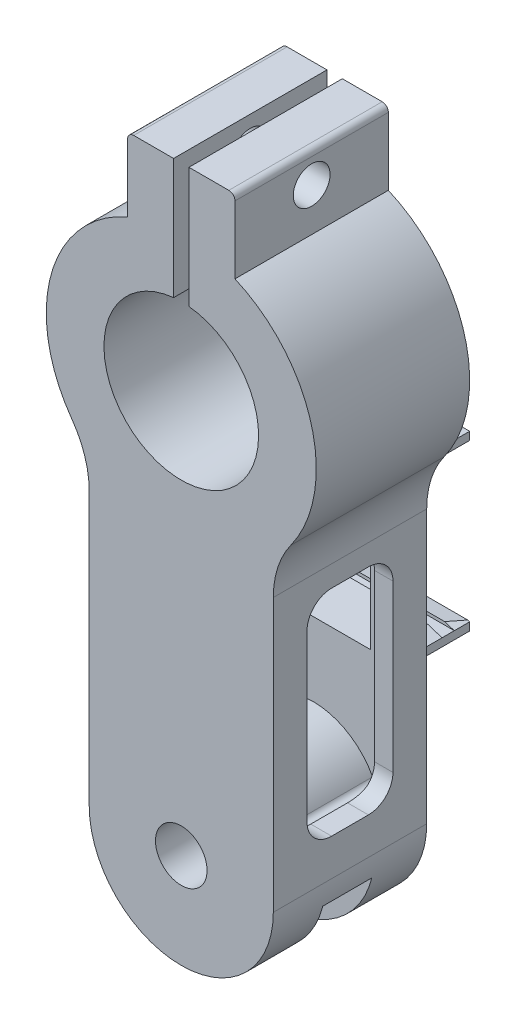
from build123d import *

# Parameters (mm, degrees)
BOSS_EXTRUDE1_DEPTH      = 25
CUT_EXTRUDE4_START       = 8.5
CUT_EXTRUDE4_DEPTH       = 8
SKETCH10_R               = 4.2
CUT_EXTRUDE6_DEPTH       = 99.764673235
SKETCH11_W               = 24
SKETCH11_H               = 29.6
BOSS_EXTRUDE2_DEPTH      = 10
CUT_EXTRUDE7_DEPTH       = 99.764673235
CUT_EXTRUDE8_START       = 5.5
SKETCH14_W               = 24
SKETCH14_H               = 25.6
CUT_EXTRUDE8_DEPTH       = 2
SKETCH22_R               = 12.6
CUT_EXTRUDE16_DEPTH      = 99.764673235
SKETCH24_W               = 17.5
SKETCH24_H               = 12
BOSS_EXTRUDE3_DEPTH      = 25
FILLET6_R                = 15
FILLET7_R                = 1
SKETCH25_R               = 3
CUT_EXTRUDE18_DEPTH      = 25
SKETCH26_W               = 2.5
SKETCH26_H               = 20
CUT_EXTRUDE19_DEPTH      = 25
SHELL14_START            = 9.25
SHELL14_DEPTH            = 1.5
SHELL14_START_2          = 3
SHELL14_2_DEPTH          = 19
SHELL14_3_OUTLINE_R      = 9.2
SHELL14_3_DEPTH          = 0.5
SHELL14_START_3          = 21.5
SHELL14_4_OUTLINE_R      = 9.2
SHELL14_4_DEPTH          = 0.5
SHELL14_START_4          = 8
SHELL14_5_DEPTH          = 2.75
SHELL14_START_5          = 19.25
SHELL14_6_DEPTH          = 1.5
SKETCH27_W               = 17.72
SKETCH27_H               = 24
CUT_EXTRUDE20_DEPTH      = 10
SKETCH28_W               = 14
SKETCH28_H               = 35
CUT_EXTRUDE21_DEPTH      = 3
SKETCH29_W               = 14
SKETCH29_H               = 35
CUT_EXTRUDE22_DEPTH      = 3
FILLET8_R                = 4
FILLET9_START            = 3.5
FILLET9_DEPTH            = 18
FILLET9_START_2          = 15.4999999
FILLET9_2_DEPTH          = 6.0000001
FILLET9_3_DEPTH          = 6
FILLET9_START_3          = 26.598008456
FILLET9_4_DEPTH          = 0.401991544
FILLET9_START_4          = 3
FILLET9_5_DEPTH          = 0.401990551
FILLET10_R               = 1
CUT_EXTRUDE23_DEPTH      = 108.947556596
CUT_EXTRUDE23_DEPTH_BACK = 108.947556596
SKETCH32_W               = 24
SKETCH32_H               = 0.7
CUT_EXTRUDE24_DEPTH      = 108.947556596
FILLET11_R               = 3
BOSS_EXTRUDE4_REACH      = 109.948
SKETCH33_W               = 28
SKETCH33_H               = 2


with BuildPart() as part:
    # Sketch1 → Boss-Extrude1 (new body)
    with BuildSketch(Plane.XY):
        with BuildLine():
            Line((30, 0), (30, 50))
            ThreePointArc((30, 50), (15, 88.093476939), (0, 50))
            Line((0, 50), (0, 0))
            ThreePointArc((0, 0), (15, -15), (30, 0))
        make_face()
    extrude(amount=BOSS_EXTRUDE1_DEPTH)

    # Sketch9 → Cut-Extrude4 (cut)
    with BuildSketch(Plane.XY.offset(CUT_EXTRUDE4_START)):
        with BuildLine():
            Line((7.015640289, 0), (0, -3.844579475))
            Line((0, -3.844579475), (0, -19.136394538))
            Line((0, -19.136394538), (30, -19.136394538))
            Line((30, -19.136394538), (30, -3.844579475))
            Line((30, -3.844579475), (22.984359711, 0))
            ThreePointArc((22.984359711, 0), (15, 8.5), (7.015640289, 0))
        make_face()
    extrude(amount=CUT_EXTRUDE4_DEPTH, mode=Mode.SUBTRACT)

    # Sketch10 → Cut-Extrude6 (cut, through all)
    with BuildSketch(Plane.XY):
        with Locations(Location((15, 0.5, 0), (0, 0, 180))):
            Circle(SKETCH10_R)
    extrude(amount=CUT_EXTRUDE6_DEPTH, mode=Mode.SUBTRACT)

    # Sketch11 → Boss-Extrude2 (add)
    with BuildSketch(Plane(origin=(0, 0, 0), x_dir=(-1, 0, 0), z_dir=(0, 0, -1))):
        with Locations((-15, 34.8)):
            Rectangle(SKETCH11_W, SKETCH11_H)
    extrude(amount=BOSS_EXTRUDE2_DEPTH)

    # Sketch12 → Cut-Extrude7 (cut, through all)
    with BuildSketch(Plane(origin=(0, 0, 0), x_dir=(-1, 0, 0), z_dir=(0, 0, -1))):
        Polygon((-3, 47.6), (-3, 22), (-6.14, 23), (-23.86, 23), (-27, 22), (-27, 47.6), (-23.86, 46.6), (-6.14, 46.6), align=None)
    extrude(amount=CUT_EXTRUDE7_DEPTH, mode=Mode.SUBTRACT)

    # Sketch14 → Cut-Extrude8 (cut)
    with BuildSketch(Plane(origin=(0, 0, 0), x_dir=(-1, 0, 0), z_dir=(0, 0, -1)).offset(CUT_EXTRUDE8_START)):
        with Locations((-15, 34.8)):
            Rectangle(SKETCH14_W, SKETCH14_H)
    extrude(amount=CUT_EXTRUDE8_DEPTH, mode=Mode.SUBTRACT)

    # Sketch22 → Cut-Extrude16 (cut, through all)
    with BuildSketch(Plane.XY):
        with Locations((15, 66.093476939)):
            Circle(SKETCH22_R)
    extrude(amount=CUT_EXTRUDE16_DEPTH, mode=Mode.SUBTRACT)

    # Sketch24 → Boss-Extrude3 (add)
    with BuildSketch(Plane.XY):
        with Locations((15, 92.278558064)):
            Rectangle(SKETCH24_W, SKETCH24_H)
    extrude(amount=BOSS_EXTRUDE3_DEPTH)

    # Fillet6
    fillet6_edges = [part.edges().sort_by_distance(p)[0] for p in [
        (0, 50, 12.5),
        (30, 50, 12.5),
    ]]
    fillet(fillet6_edges, radius=FILLET6_R)

    # Fillet7
    fillet7_edges = [part.edges().sort_by_distance(p)[0] for p in [
        (6.25, 98.278558064, 12.5),
        (23.75, 98.278558064, 12.5),
    ]]
    fillet(fillet7_edges, radius=FILLET7_R)

    # Sketch25 → Cut-Extrude18 (cut)
    with BuildSketch(Plane(origin=(23.75, 0, 23.75), x_dir=(0, 0, 1), z_dir=(-1, 0, 0))):
        with Locations(Location((-11.25, 93.278558064, 0), (0, 0, 180))):
            Circle(SKETCH25_R)
    extrude(amount=CUT_EXTRUDE18_DEPTH, mode=Mode.SUBTRACT)

    # Sketch26 → Cut-Extrude19 (cut)
    with BuildSketch(Plane(origin=(0, 0, 0), x_dir=(-1, 0, 0), z_dir=(0, 0, -1))):
        with Locations((-15, 88.278558064)):
            Rectangle(SKETCH26_W, SKETCH26_H)
    extrude(amount=-CUT_EXTRUDE19_DEPTH, mode=Mode.SUBTRACT)

    # Shell14: read off the stored shape, not the designer's step
    # Shell14 outline → Shell14 (cut)
    with BuildSketch(Plane.YZ.offset(SHELL14_START)):
        with BuildLine():
            Line((93.278558064, 22), (88.278558064, 22))
            Line((88.278558064, 22), (88.278558064, 15.81662479))
            ThreePointArc((88.278558064, 15.81662479), (90.441283733, 17.786764074), (93.278558064, 18.5))
            Line((93.278558064, 18.5), (93.278558064, 22))
        make_face()
        with BuildLine():
            ThreePointArc((93.278558064, 6.5), (90.441283733, 7.213235926), (88.278558064, 9.18337521))
            Line((88.278558064, 9.18337521), (88.278558064, 3))
            Line((88.278558064, 3), (93.278558064, 3))
            Line((93.278558064, 3), (93.278558064, 6.5))
        make_face()
    extrude(amount=SHELL14_DEPTH, mode=Mode.SUBTRACT)

    # Shell14 2 outline → Shell14 2 (cut)
    with BuildSketch(Plane.XY.offset(SHELL14_START_2)):
        with BuildLine():
            Line((20.75, 88.278558064), (19.25, 88.278558064))
            Line((19.25, 88.278558064), (19.25, 81.10339033))
            ThreePointArc((19.25, 81.10339033), (15, 50.493476939), (10.75, 81.10339033))
            Line((10.75, 81.10339033), (10.75, 88.278558064))
            Line((10.75, 88.278558064), (9.25, 88.278558064))
            Line((9.25, 88.278558064), (9.25, 84.202521641))
            ThreePointArc((9.25, 84.202521641), (-3.041191716, 72.052956906), (-0.405405405, 54.972618866))
            ThreePointArc((-0.405405405, 54.972618866), (2.127502776, 49.973191279), (3, 44.437069112))
            Line((3, 44.437069112), (3, 3.500970796))
            Line((3, 3.500970796), (4.734171365, 4.451298829))
            ThreePointArc((4.734171365, 4.451298829), (15, 11.5), (25.265828635, 4.451298829))
            Line((25.265828635, 4.451298829), (27, 3.500970796))
            Line((27, 3.500970796), (27, 44.437069112))
            ThreePointArc((27, 44.437069112), (27.872497224, 49.973191279), (30.405405405, 54.972618866))
            ThreePointArc((30.405405405, 54.972618866), (33.041191716, 72.052956906), (20.75, 84.202521641))
            Line((20.75, 84.202521641), (20.75, 88.278558064))
        make_face()
    extrude(amount=SHELL14_2_DEPTH, mode=Mode.SUBTRACT)

    # Shell14 3 outline → Shell14 3 (cut)
    with BuildSketch(Plane.XY.offset(SHELL14_START_2)):
        with BuildLine():
            Line((27, 0), (27, 3.500970796))
            Line((27, 3.500970796), (25.265828635, 4.451298829))
            ThreePointArc((25.265828635, 4.451298829), (15, 11.5), (4.734171365, 4.451298829))
            Line((4.734171365, 4.451298829), (3, 3.500970796))
            Line((3, 3.500970796), (3, 0))
            ThreePointArc((3, 0), (15, -12), (27, 0))
        make_face()
        with Locations((15, 0.5)):
            Circle(SHELL14_3_OUTLINE_R, mode=Mode.SUBTRACT)
    extrude(amount=SHELL14_3_DEPTH, mode=Mode.SUBTRACT)

    # Shell14 4 outline → Shell14 4 (cut)
    with BuildSketch(Plane.XY.offset(SHELL14_START_3)):
        with BuildLine():
            Line((27, 0), (27, 3.500970796))
            Line((27, 3.500970796), (25.265828635, 4.451298829))
            ThreePointArc((25.265828635, 4.451298829), (15, 11.5), (4.734171365, 4.451298829))
            Line((4.734171365, 4.451298829), (3, 3.500970796))
            Line((3, 3.500970796), (3, 0))
            ThreePointArc((3, 0), (15, -12), (27, 0))
        make_face()
        with Locations((15, 0.5)):
            Circle(SHELL14_4_OUTLINE_R, mode=Mode.SUBTRACT)
    extrude(amount=SHELL14_4_DEPTH, mode=Mode.SUBTRACT)

    # Shell14 5 outline → Shell14 5 (add)
    with BuildSketch(Plane.YZ.offset(SHELL14_START_4)):
        with BuildLine():
            Line((88.278558064, 9.18337521), (88.278558064, 15.81662479))
            ThreePointArc((88.278558064, 15.81662479), (87.278558064, 12.5), (88.278558064, 9.18337521))
        make_face()
    extrude(amount=SHELL14_5_DEPTH)

    # Shell14 6 outline → Shell14 6 (add)
    with BuildSketch(Plane.YZ.offset(SHELL14_START_5)):
        with BuildLine():
            Line((88.278558064, 9.18337521), (88.278558064, 15.81662479))
            ThreePointArc((88.278558064, 15.81662479), (87.278558064, 12.5), (88.278558064, 9.18337521))
        make_face()
    extrude(amount=SHELL14_6_DEPTH)

    # Sketch27 → Cut-Extrude20 (cut)
    with BuildSketch(Plane(origin=(0, 0, 0), x_dir=(-1, 0, 0), z_dir=(0, 0, -1))):
        with Locations((-15, 35)):
            Rectangle(SKETCH27_W, SKETCH27_H)
    extrude(amount=-CUT_EXTRUDE20_DEPTH, mode=Mode.SUBTRACT)

    # Sketch28 → Cut-Extrude21 (cut)
    with BuildSketch(Plane.ZY):
        with Locations((12.5, 23.5)):
            Rectangle(SKETCH28_W, SKETCH28_H)
    extrude(amount=-CUT_EXTRUDE21_DEPTH, mode=Mode.SUBTRACT)

    # Sketch29 → Cut-Extrude22 (cut)
    with BuildSketch(Plane(origin=(30, 0, -30), x_dir=(0, 0, 1), z_dir=(-1, 0, 0))):
        with Locations((42.5, 23.5)):
            Rectangle(SKETCH29_W, SKETCH29_H)
    extrude(amount=CUT_EXTRUDE22_DEPTH, mode=Mode.SUBTRACT)

    # Fillet8
    fillet8_edges = [part.edges().sort_by_distance(p)[0] for p in [
        (1.5, 6, 19.5),
        (1.5, 41, 19.5),
        (1.5, 41, 5.5),
        (1.5, 6, 5.5),
        (28.5, 41, 5.5),
        (28.5, 6, 5.5),
        (28.5, 6, 19.5),
        (28.5, 41, 19.5),
    ]]
    fillet(fillet8_edges, radius=FILLET8_R)

    # Fillet9: read off the stored shape, not the designer's step
    # Fillet9 outline → Fillet9 (add)
    with BuildSketch(Plane.XY.offset(FILLET9_START)):
        with BuildLine():
            Line((3.401990551, 6), (3, 6))
            Line((3, 6), (3, 3.500970796))
            Line((3, 3.500970796), (4.734171365, 4.451298829))
            ThreePointArc((4.734171365, 4.451298829), (3.967547511, 5.139171318), (3.401990551, 6))
        make_face()
        with BuildLine():
            Line((27, 3.500970796), (27, 6))
            Line((27, 6), (26.598009449, 6))
            ThreePointArc((26.598009449, 6), (26.032452489, 5.139171318), (25.265828635, 4.451298829))
            Line((25.265828635, 4.451298829), (27, 3.500970796))
        make_face()
    extrude(amount=FILLET9_DEPTH)

    # Fillet9 2 outline → Fillet9 2 (add)
    with BuildSketch(Plane.XY.offset(FILLET9_START_2)):
        with BuildLine():
            Line((3, 7.747663584), (3, 6))
            Line((3, 6), (3.401990551, 6))
            ThreePointArc((3.401990551, 6), (3.101792861, 6.851013651), (3, 7.747663584))
        make_face()
        with BuildLine():
            Line((26.598009449, 6), (27, 6))
            Line((27, 6), (27, 7.747663584))
            ThreePointArc((27, 7.747663584), (26.898207139, 6.851013651), (26.598009449, 6))
        make_face()
    extrude(amount=FILLET9_2_DEPTH)

    # Fillet9 3 outline → Fillet9 3 (add)
    with BuildSketch(Plane.XY.offset(FILLET9_START)):
        with BuildLine():
            Line((3, 7.747663584), (3, 6))
            Line((3, 6), (3.401990551, 6))
            ThreePointArc((3.401990551, 6), (3.101792861, 6.851013651), (3, 7.747663584))
        make_face()
        with BuildLine():
            Line((26.598009449, 6), (27, 6))
            Line((27, 6), (27, 7.747663584))
            ThreePointArc((27, 7.747663584), (26.898207139, 6.851013651), (26.598009449, 6))
        make_face()
    extrude(amount=FILLET9_3_DEPTH)

    # Fillet9 4 outline → Fillet9 4 (cut)
    with BuildSketch(Plane.YZ.offset(FILLET9_START_3)):
        with BuildLine():
            ThreePointArc((6, 9.5), (6.463805318, 7.630420591), (7.747663584, 6.194401617))
            Line((7.747663584, 6.194401617), (7.747663584, 9.5))
            Line((7.747663584, 9.5), (6, 9.5))
        make_face()
        with BuildLine():
            Line((6, 15.5), (7.747663584, 15.4999999))
            Line((7.747663584, 15.4999999), (7.747663584, 18.805598383))
            ThreePointArc((7.747663584, 18.805598383), (6.463805318, 17.369579409), (6, 15.5))
        make_face()
    extrude(amount=FILLET9_4_DEPTH, mode=Mode.SUBTRACT)

    # Fillet9 5 outline → Fillet9 5 (cut)
    with BuildSketch(Plane.YZ.offset(FILLET9_START_4)):
        with BuildLine():
            ThreePointArc((6, 9.5), (6.463805318, 7.630420591), (7.747663584, 6.194401617))
            Line((7.747663584, 6.194401617), (7.747663584, 9.5))
            Line((7.747663584, 9.5), (6, 9.5))
        make_face()
        with BuildLine():
            Line((6, 15.5), (7.747663584, 15.4999999))
            Line((7.747663584, 15.4999999), (7.747663584, 18.805598383))
            ThreePointArc((7.747663584, 18.805598383), (6.463805318, 17.369579409), (6, 15.5))
        make_face()
    extrude(amount=FILLET9_5_DEPTH, mode=Mode.SUBTRACT)

    # Fillet10
    fillet10_edges = [part.edges().sort_by_distance(p)[0] for p in [
        (25.265828635, 4.451298829, 12.5),
        (4.734171365, 4.451298829, 12.5),
    ]]
    fillet(fillet10_edges, radius=FILLET10_R)

    # Sketch30 → Cut-Extrude23 (cut, two sides: drawn at the far end of the back side and taken through both)
    with BuildSketch(Plane(origin=(0, 0, 0), x_dir=(0, 0, -1), z_dir=(1, 0, 0)).offset(-CUT_EXTRUDE23_DEPTH_BACK)):
        Polygon((10, 47.5), (10, 46.6), (7.5, 46.6), (7.5, 47.1), align=None)
        Polygon((10, 22.1), (10, 23), (7.5, 23), (7.5, 22.5), align=None)
    extrude(amount=CUT_EXTRUDE23_DEPTH + CUT_EXTRUDE23_DEPTH_BACK, mode=Mode.SUBTRACT)

    # Sketch32 → Cut-Extrude24 (cut, through all)
    with BuildSketch(Plane(origin=(0, 0, 0), x_dir=(-1, 0, 0), z_dir=(0, 0, -1))):
        with Locations((-15, 49.25)):
            Rectangle(SKETCH32_W, SKETCH32_H)
        with Locations((-15, 20.35)):
            Rectangle(SKETCH32_W, SKETCH32_H)
    extrude(amount=CUT_EXTRUDE24_DEPTH, mode=Mode.SUBTRACT)

    # Fillet11
    fillet11_edges = [part.edges().sort_by_distance(p)[0] for p in [
        (15, 48.9, 0),
        (15, 20.7, 0),
    ]]
    fillet(fillet11_edges, radius=FILLET11_R)

    # Sketch33 → Boss-Extrude4 (add, up to next)
    with BuildSketch(Plane(origin=(0, 0, 0), x_dir=(-1, 0, 0), z_dir=(0, 0, -1)), mode=Mode.PRIVATE) as boss_extrude4_sk1:
        with Locations((-15, 48)):
            Rectangle(SKETCH33_W, SKETCH33_H)
    boss_extrude4_tool1 = extrude(boss_extrude4_sk1.sketch, amount=-BOSS_EXTRUDE4_REACH, mode=Mode.PRIVATE) - part.part
    add(boss_extrude4_tool1.solids().sort_by_distance((15, 48, 0))[0])


solid = part.part
